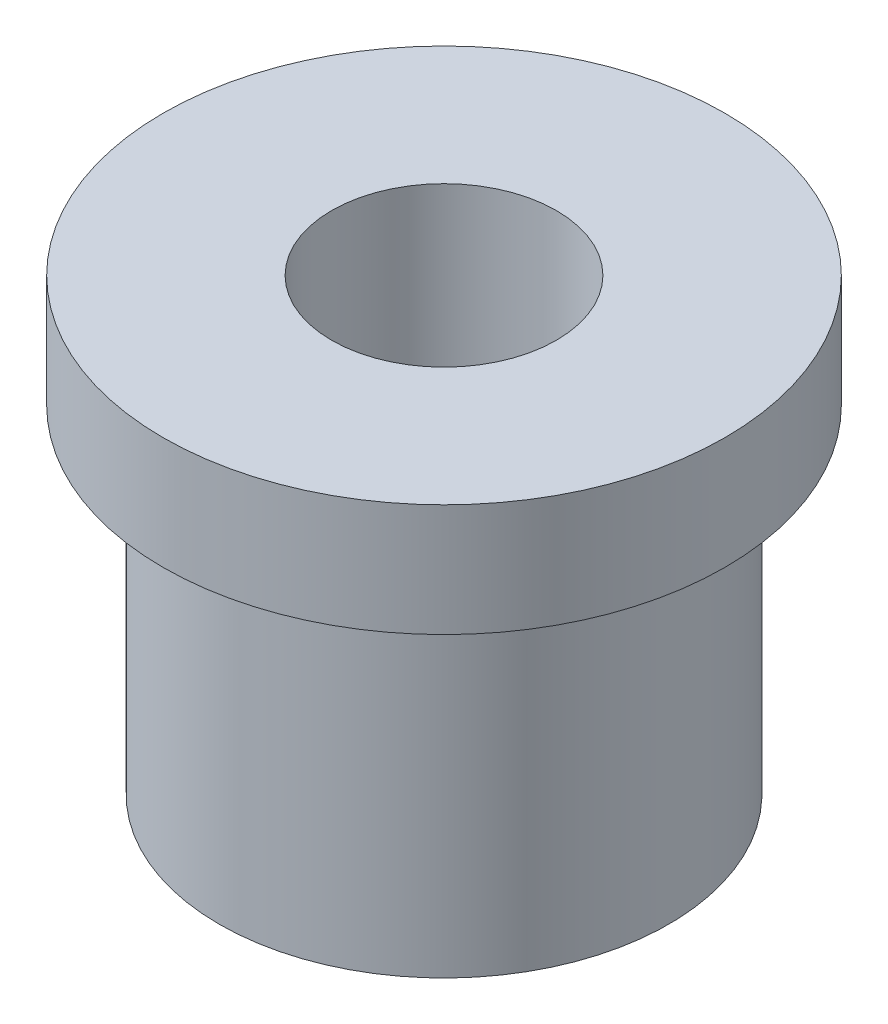
from build123d import *

# Parameters (mm, degrees)
CUT_EXTRUDE1_REACH = 28.693
SKETCH2_R          = 5


with BuildPart() as part:
    # Sketch1 → Revolve1 (revolve)
    with BuildSketch(Plane.XY):
        Polygon((0, 0), (12.5, 0), (12.5, -5), (10, -5), (10, -20), (0, -20), align=None)
    revolve(axis=Axis((0, -25, 0), (0, 1, 0)))

    # Sketch2 → Cut-Extrude1 (cut, up to next)
    with BuildSketch(Plane(origin=(0, 0, 0), x_dir=(1, 0, 0), z_dir=(0, 1, 0)), mode=Mode.PRIVATE) as cut_extrude1_sk1:
        Circle(SKETCH2_R)
    cut_extrude1_tool1 = extrude(cut_extrude1_sk1.sketch, amount=-CUT_EXTRUDE1_REACH, mode=Mode.PRIVATE) & part.part
    add(cut_extrude1_tool1.solids().sort_by_distance((0, 0, 0))[0], mode=Mode.SUBTRACT)


solid = part.part
